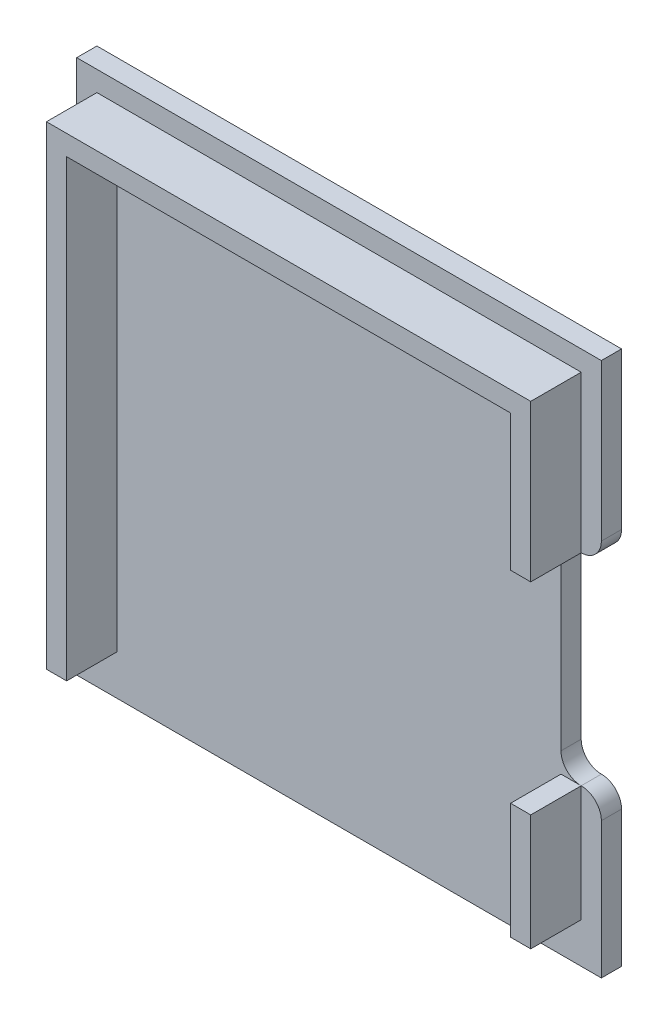
from build123d import *

# Parameters (mm, degrees)
SKETCH1_W           = 52
SKETCH1_H           = 53
BOSS_EXTRUDE1_DEPTH = 2
SKETCH2_W           = 48
SKETCH2_H           = 49
SKETCH2_W_2         = 44
SKETCH2_H_2         = 45
BOSS_EXTRUDE2_DEPTH = 5
CUT_EXTRUDE1_START  = -7
SKETCH3_W           = 4
SKETCH3_H           = 20
CUT_EXTRUDE1_DEPTH  = 7
FILLET1_R           = 2
SKETCH4_W           = 48
SKETCH4_H           = 2
CUT_EXTRUDE2_DEPTH  = 5


with BuildPart() as part:
    # Sketch1 → Boss-Extrude1 (new body)
    with BuildSketch(Plane.XY):
        with Locations((26, 26.5)):
            Rectangle(SKETCH1_W, SKETCH1_H)
    extrude(amount=BOSS_EXTRUDE1_DEPTH)

    # Sketch2 → Boss-Extrude2 (add)
    with BuildSketch(Plane.XY.offset(2)):
        with Locations((26, 26.5)):
            Rectangle(SKETCH2_W, SKETCH2_H)
        with Locations((26, 26.5)):
            Rectangle(SKETCH2_W_2, SKETCH2_H_2, mode=Mode.SUBTRACT)
    extrude(amount=BOSS_EXTRUDE2_DEPTH)

    # Sketch3 → Cut-Extrude1 (cut)
    with BuildSketch(Plane(origin=(0, 0, 0), x_dir=(-1, 0, 0), z_dir=(0, 0, -1)).offset(CUT_EXTRUDE1_START)):
        with Locations((-50, 25.5)):
            Rectangle(SKETCH3_W, SKETCH3_H)
    extrude(amount=CUT_EXTRUDE1_DEPTH, mode=Mode.SUBTRACT)

    # Fillet1
    fillet1_edges = [part.edges().sort_by_distance(p)[0] for p in [
        (48, 15.5, 1),
        (48, 35.5, 1),
    ]]
    fillet(fillet1_edges, radius=FILLET1_R)
    fillet1_2_edges = [part.edges().sort_by_distance(p)[0] for p in [
        (52, 15.5, 1),
        (52, 35.5, 1),
    ]]
    fillet(fillet1_2_edges, radius=FILLET1_R - 0.0001)  # a hair under: the kernel refuses the full size

    # Sketch4 → Cut-Extrude2 (cut)
    with BuildSketch(Plane.XY.offset(7)):
        with Locations((26, 3)):
            Rectangle(SKETCH4_W, SKETCH4_H)
    extrude(amount=-CUT_EXTRUDE2_DEPTH, mode=Mode.SUBTRACT)


solid = part.part
